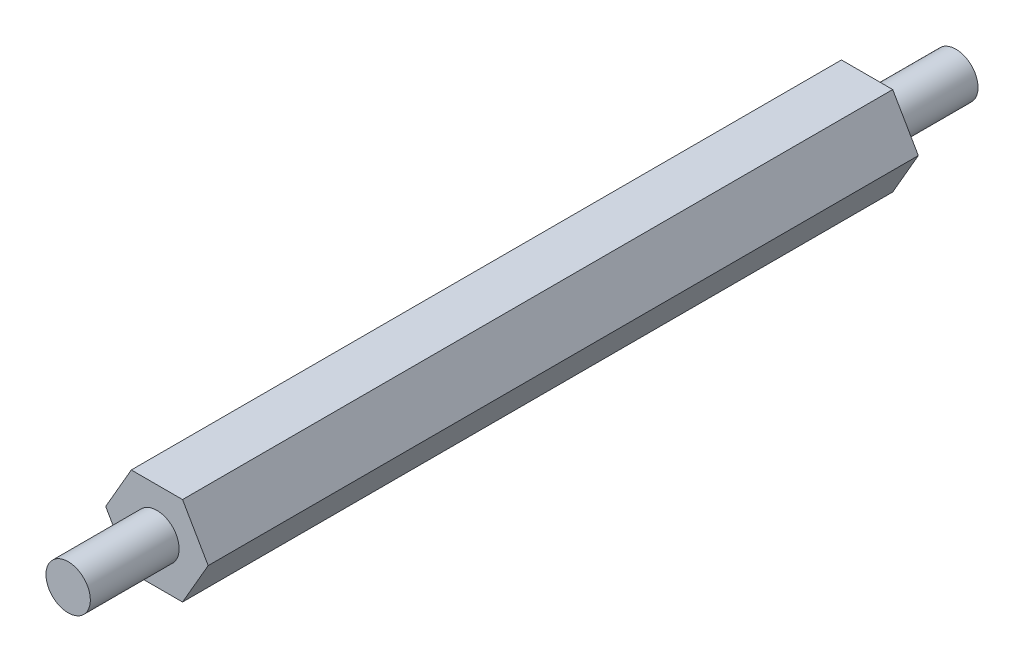
from build123d import *

# Parameters (mm, degrees)
SM_BASE_FLANGE_1_DEPTH = 48
SKETCH_6_R             = 1.5
EXTRUDE_1_DEPTH        = 6
EXTRUDE_START          = 6
SKETCH_7_R             = 1.5
EXTRUDE_2_DEPTH        = 6


# Sheet-metal steps are written as plain solids
with BuildPart() as part:
    # Sketch 1 → 基体-法兰1 (new body)
    with BuildSketch(Plane.XY):
        Polygon((3.464101615, 0), (1.732050808, 3), (-1.732050808, 3), (-3.464101615, 0), (-1.732050808, -3), (1.732050808, -3), align=None)
    extrude(amount=-SM_BASE_FLANGE_1_DEPTH)

    # 草图6 → 凸台-拉伸1 (add)
    with BuildSketch(Plane.XY):
        Circle(SKETCH_6_R)
    extrude(amount=EXTRUDE_1_DEPTH)

    # 草图7 → 凸台-拉伸2 (add)
    with BuildSketch(Plane(origin=(0, 0, -48), x_dir=(-1, 0, 0), z_dir=(0, 0, -1)).offset(EXTRUDE_START)):
        with Locations(Location((0, 0, 0), (0, 0, 180))):
            Circle(SKETCH_7_R)
    extrude(amount=-EXTRUDE_2_DEPTH)


solid = part.part
